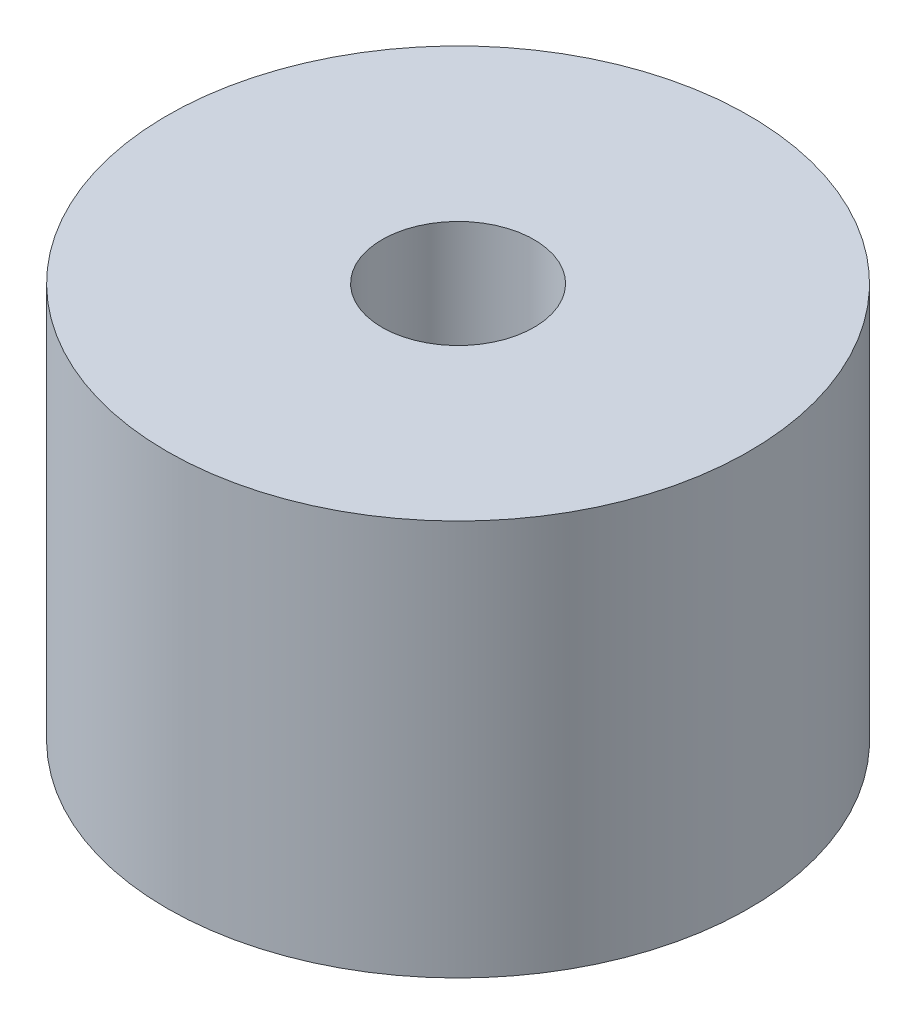
from build123d import *

# Parameters (mm, degrees)
SKETCH1_R              = 9.525
BOSS_EXTRUDE1_DEPTH    = 12.954
F_10_CLEARANCE_HOLE1_D = 4.9784


with BuildPart() as part:
    # Sketch1 → Boss-Extrude1 (new body)
    with BuildSketch(Plane(origin=(0, 0, 0), x_dir=(1, 0, 0), z_dir=(0, 1, 0))):
        Circle(SKETCH1_R)
    extrude(amount=BOSS_EXTRUDE1_DEPTH)

    # #10 Clearance Hole1 (through all)
    with Locations(Plane(origin=(0, 12.954, 0), x_dir=(1, 0, 0), z_dir=(0, 1, 0))):
        with Locations((0, 0)):
            Hole(F_10_CLEARANCE_HOLE1_D / 2)


solid = part.part
